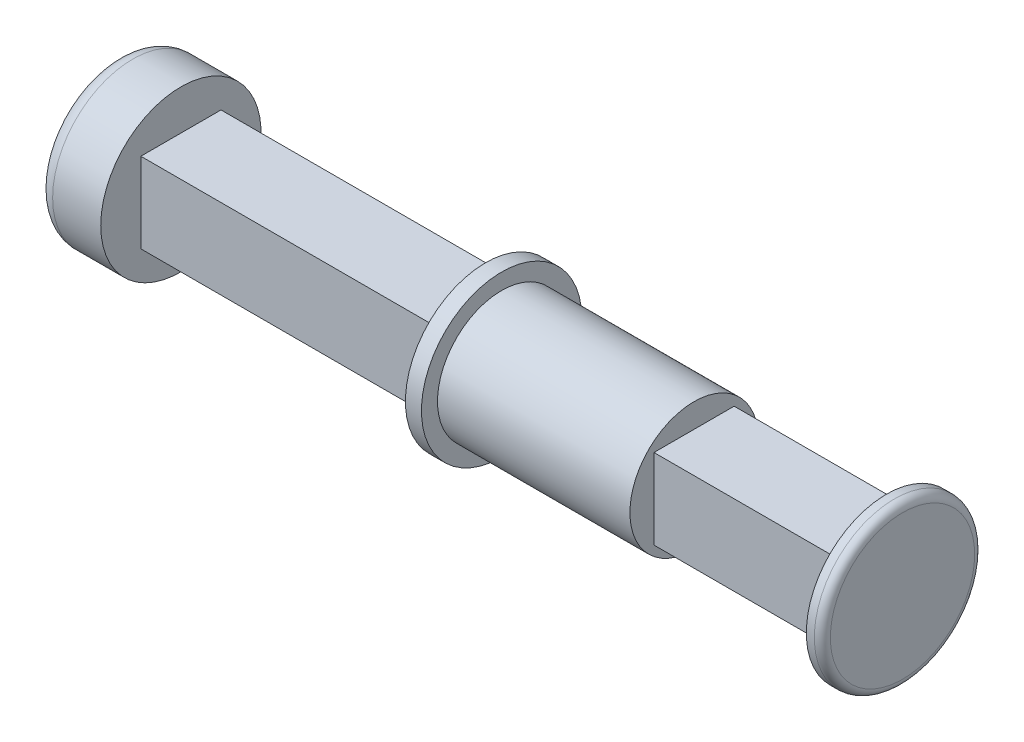
from build123d import *

# Parameters (mm, degrees)
SKETCH1_W                    = 50
SKETCH1_H                    = 50
BOSS_EXTRUDE1_DEPTH          = 95
SKETCH2_R                    = 50
BOSS_EXTRUDE2_DEPTH          = 10
SKETCH3_R                    = 40
BOSS_EXTRUDE3_DEPTH          = 120
BOSS_EXTRUDE4_START          = 40
SKETCH4_R                    = 50
BOSS_EXTRUDE4_DEPTH          = 40
SCHIZZO1_W                   = 50
SCHIZZO1_H                   = 50
BOSS_EXTRUDE5_DEPTH          = 120
RACCORDO1_R                  = 10
SCHIZZO2_R                   = 50
ESTRUSIONE_ESTRUSIONE1_DEPTH = 10
RACCORDO2_R                  = 5


with BuildPart() as part:
    # Sketch1 → Boss-Extrude1 (new, symmetric)
    with BuildSketch(Plane(origin=(0, 0, 0), x_dir=(0, 0, -1), z_dir=(1, 0, 0))):
        Rectangle(SKETCH1_W, SKETCH1_H)
    extrude(amount=BOSS_EXTRUDE1_DEPTH, both=True)

    # Sketch2 → Boss-Extrude2 (add)
    with BuildSketch(Plane(origin=(95, 0, 0), x_dir=(0, 0, -1), z_dir=(1, 0, 0))):
        Circle(SKETCH2_R)
    extrude(amount=BOSS_EXTRUDE2_DEPTH)

    # Sketch3 → Boss-Extrude3 (add)
    with BuildSketch(Plane(origin=(105, 0, 0), x_dir=(0, 0, -1), z_dir=(1, 0, 0))):
        Circle(SKETCH3_R)
    extrude(amount=BOSS_EXTRUDE3_DEPTH)

    # Sketch4 → Boss-Extrude4 (add)
    with BuildSketch(Plane.ZY.offset(95).offset(BOSS_EXTRUDE4_START)):
        Circle(SKETCH4_R)
    extrude(amount=-BOSS_EXTRUDE4_DEPTH)

    # Schizzo1 → Boss-Extrude5 (add)
    with BuildSketch(Plane(origin=(225, 0, 0), x_dir=(0, 0, -1), z_dir=(1, 0, 0))):
        Rectangle(SCHIZZO1_W, SCHIZZO1_H)
    extrude(amount=BOSS_EXTRUDE5_DEPTH)

    # Raccordo1
    raccordo1_edges = [part.edges().sort_by_distance(p)[0] for p in [
        (-135, 0, -50),
    ]]
    fillet(raccordo1_edges, radius=RACCORDO1_R)

    # Schizzo2 → Estrusione-Estrusione1 (add)
    with BuildSketch(Plane(origin=(345, 0, 0), x_dir=(0, 0, -1), z_dir=(1, 0, 0))):
        Circle(SCHIZZO2_R)
    extrude(amount=ESTRUSIONE_ESTRUSIONE1_DEPTH)

    # Raccordo2
    raccordo2_edges = [part.edges().sort_by_distance(p)[0] for p in [
        (355, 0, 50),
    ]]
    fillet(raccordo2_edges, radius=RACCORDO2_R)


solid = part.part
